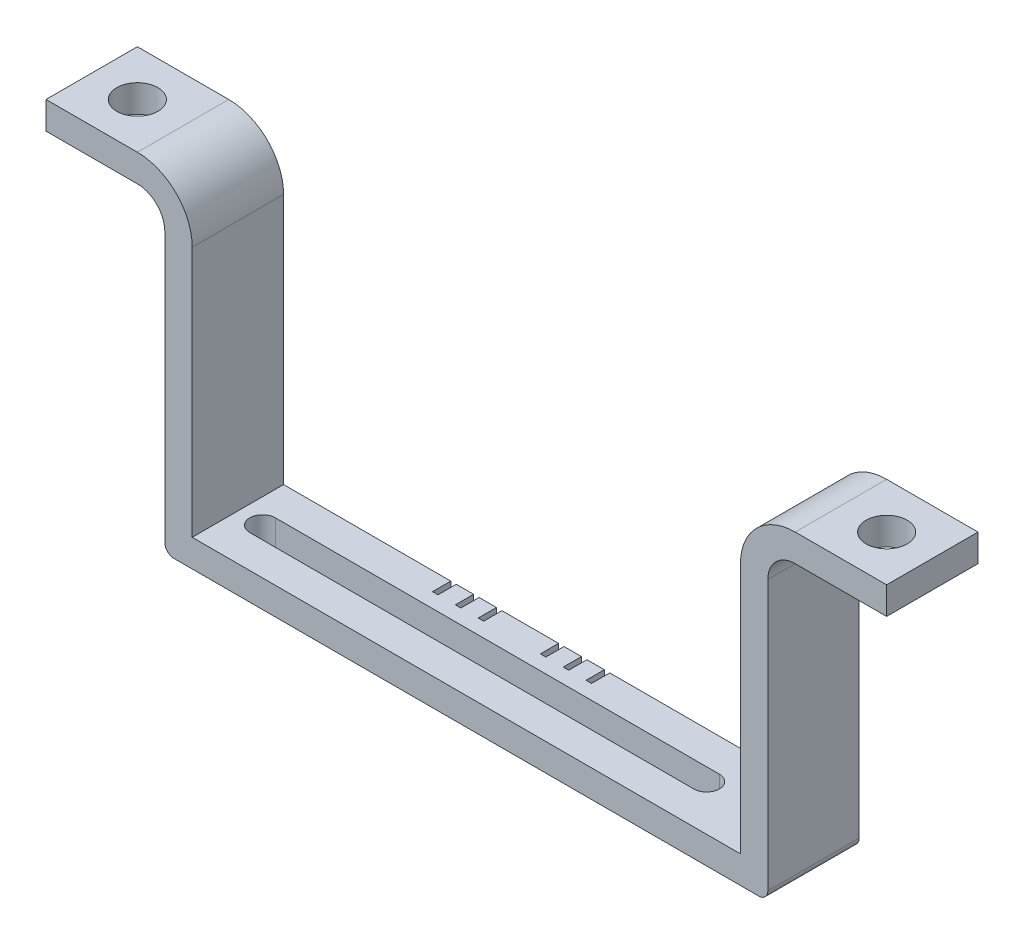
from build123d import *

# Parameters (mm, degrees)
BOSS_EXTRUDE1_DEPTH = 5
CUT_EXTRUDE1_DEPTH  = 58.124863238
SKETCH5_R           = 2.25
CUT_EXTRUDE2_DEPTH  = 59.934285437
SKETCH6_W           = 0.6
SKETCH6_H           = 2
CUT_EXTRUDE3_DEPTH  = 0.6


with BuildPart() as part:
    # Sketch1 → Boss-Extrude1 (new, symmetric)
    with BuildSketch(Plane.XY):
        with BuildLine():
            Line((-46, 33.5), (-36, 33.5))
            ThreePointArc((-36, 33.5), (-31.757359313, 31.742640687), (-30, 27.5))
            Line((-30, 27.5), (-30, 0))
            Line((-30, 0), (30, 0))
            Line((30, 0), (30, 27.5))
            ThreePointArc((30, 27.5), (31.757359313, 31.742640687), (36, 33.5))
            Line((36, 33.5), (46, 33.5))
            Line((46, 33.5), (46, 30.5))
            Line((46, 30.5), (36, 30.5))
            ThreePointArc((36, 30.5), (33.878679656, 29.621320344), (33, 27.5))
            Line((33, 27.5), (33, -2))
            ThreePointArc((33, -2), (32.707106781, -2.707106781), (32, -3))
            Line((32, -3), (-32, -3))
            ThreePointArc((-32, -3), (-32.707106781, -2.707106781), (-33, -2))
            Line((-33, -2), (-33, 27.5))
            ThreePointArc((-33, 27.5), (-33.878679656, 29.621320344), (-36, 30.5))
            Line((-36, 30.5), (-46, 30.5))
            Line((-46, 30.5), (-46, 33.5))
        make_face()
    extrude(amount=BOSS_EXTRUDE1_DEPTH, both=True)

    # Sketch3 → Cut-Extrude1 (cut, through all)
    with BuildSketch(Plane(origin=(0, 0, 0), x_dir=(1, 0, 0), z_dir=(0, 1, 0))):
        with BuildLine():
            Line((-27.3, 1.4), (21.3, 1.4))
            ThreePointArc((21.3, 1.4), (22.7, 0), (21.3, -1.4))
            Line((21.3, -1.4), (-27.3, -1.4))
            ThreePointArc((-27.3, -1.4), (-28.7, 0), (-27.3, 1.4))
        make_face()
    extrude(amount=-CUT_EXTRUDE1_DEPTH, mode=Mode.SUBTRACT)

    # Sketch5 → Cut-Extrude2 (cut, through all)
    with BuildSketch(Plane(origin=(0, 33.5, 0), x_dir=(1, 0, 0), z_dir=(0, 1, 0))):
        with Locations((-41, 0)):
            Circle(SKETCH5_R)
        with Locations((41, 0)):
            Circle(SKETCH5_R)
    extrude(amount=-CUT_EXTRUDE2_DEPTH, mode=Mode.SUBTRACT)

    # Sketch6 → Cut-Extrude3 (cut)
    with BuildSketch(Plane(origin=(0, 0, 0), x_dir=(1, 0, 0), z_dir=(0, 1, 0))):
        with Locations((-6.4, 4)):
            Rectangle(SKETCH6_W, SKETCH6_H)
        with Locations((-11.4, 4)):
            Rectangle(SKETCH6_W, SKETCH6_H)
        with Locations((0.4, 4)):
            Rectangle(SKETCH6_W, SKETCH6_H)
        with Locations((-8.9, 4)):
            Rectangle(SKETCH6_W, SKETCH6_H)
        with Locations((2.9, 4)):
            Rectangle(SKETCH6_W, SKETCH6_H)
        with Locations((5.4, 4)):
            Rectangle(SKETCH6_W, SKETCH6_H)
    extrude(amount=-CUT_EXTRUDE3_DEPTH, mode=Mode.SUBTRACT)


solid = part.part
